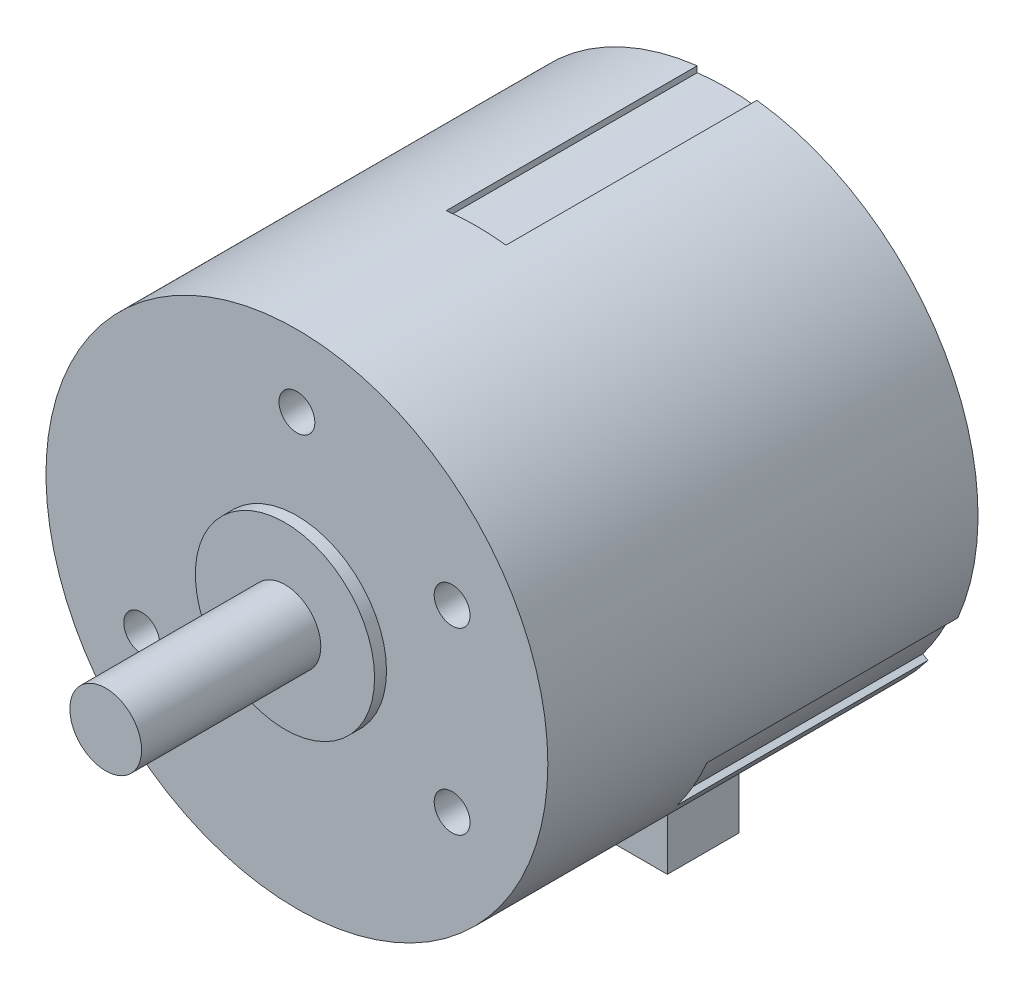
from build123d import *
from build123d.topology import SkipClean

# Parameters (mm, degrees)
SKETCH_1_R          = 21
EXTRUDE_1_DEPTH     = 15
EXTRUDE_START       = 6
EXTRUDE_2_DEPTH     = 6
EXTRUDE_3_DEPTH     = 6
EXTRUDE_START_2     = 9
EXTRUDE_4_DEPTH     = 9
SKETCH_6_R          = 7.5
EXTRUDE_5_DEPTH     = 1
SKETCH_7_R          = 3
EXTRUDE_6_DEPTH     = 15
SKETCH_8_R          = 1.5
CUT_EXTRUDE_1_DEPTH = 3


with BuildPart() as part:
    # 草图1 → 凸台-拉伸1 (new body)
    with BuildSketch(Plane.XY):
        Circle(SKETCH_1_R)
    extrude(amount=EXTRUDE_1_DEPTH)

    # 草图2 → 凸台-拉伸2 (add)
    with SkipClean():  # the faces are left unmerged after this step: merging them gives an invalid solid
        with BuildSketch(Plane(origin=(0, 0, 0), x_dir=(-1, 0, 0), z_dir=(0, 0, -1)).offset(EXTRUDE_START)):
            with BuildLine():
                Line((2.5, 20.850659462), (2.5, 20.346989949))
                ThreePointArc((2.5, 20.346989949), (0, 20.5), (-2.5, 20.346989949))
                Line((-2.5, 20.346989949), (-2.5, 20.850659462))
                ThreePointArc((-2.5, 20.850659462), (-18.186533479, 10.5), (-19.30720078, -8.260266222))
                Line((-19.30720078, -8.260266222), (-18.871010187, -8.008431465))
                ThreePointArc((-18.871010187, -8.008431465), (-17.753520778, -10.25), (-16.371010187, -12.338558484))
                Line((-16.371010187, -12.338558484), (-16.80720078, -12.59039324))
                ThreePointArc((-16.80720078, -12.59039324), (-15.938440593, -13.673555187), (-15, -14.696938457))
                Line((-15, -14.696938457), (-15, -13.973188612))
                ThreePointArc((-15, -13.973188612), (0, -20.5), (15, -13.973188612))
                Line((15, -13.973188612), (15, -14.696938457))
                ThreePointArc((15, -14.696938457), (15.938440593, -13.673555187), (16.80720078, -12.59039324))
                Line((16.80720078, -12.59039324), (16.371010187, -12.338558484))
                ThreePointArc((16.371010187, -12.338558484), (17.753520778, -10.25), (18.871010187, -8.008431465))
                Line((18.871010187, -8.008431465), (19.30720078, -8.260266222))
                ThreePointArc((19.30720078, -8.260266222), (18.186533479, 10.5), (2.5, 20.850659462))
            make_face()
        extrude(amount=-EXTRUDE_2_DEPTH)

    # 草图4 → 凸台-拉伸3 (add)
    with SkipClean():  # the faces are left unmerged after this step: merging them gives an invalid solid
        with BuildSketch(Plane(origin=(0, 0, -6), x_dir=(-1, 0, 0), z_dir=(0, 0, -1)).offset(EXTRUDE_START)):
            with BuildLine():
                Line((10, -17.895530168), (10, -24))
                Line((10, -24), (-10, -24))
                Line((-10, -24), (-10, -17.895530168))
                ThreePointArc((-10, -17.895530168), (-12.652912345, -16.129284212), (-15, -13.973188612))
                Line((-15, -13.973188612), (-15, -14.696938457))
                ThreePointArc((-15, -14.696938457), (-15.938440593, -13.673555187), (-16.80720078, -12.59039324))
                Line((-16.80720078, -12.59039324), (-16.371010187, -12.338558484))
                ThreePointArc((-16.371010187, -12.338558484), (-17.753520778, -10.25), (-18.871010187, -8.008431465))
                Line((-18.871010187, -8.008431465), (-19.30720078, -8.260266222))
                ThreePointArc((-19.30720078, -8.260266222), (-18.186533479, 10.5), (-2.5, 20.850659462))
                Line((-2.5, 20.850659462), (-2.5, 20.346989949))
                ThreePointArc((-2.5, 20.346989949), (0, 20.5), (2.5, 20.346989949))
                Line((2.5, 20.346989949), (2.5, 20.850659462))
                ThreePointArc((2.5, 20.850659462), (18.186533479, 10.5), (19.30720078, -8.260266222))
                Line((19.30720078, -8.260266222), (18.871010187, -8.008431465))
                ThreePointArc((18.871010187, -8.008431465), (17.753520778, -10.25), (16.371010187, -12.338558484))
                Line((16.371010187, -12.338558484), (16.80720078, -12.59039324))
                ThreePointArc((16.80720078, -12.59039324), (15.938440593, -13.673555187), (15, -14.696938457))
                Line((15, -14.696938457), (15, -13.973188612))
                ThreePointArc((15, -13.973188612), (12.652912345, -16.129284212), (10, -17.895530168))
            make_face()
        extrude(amount=-EXTRUDE_3_DEPTH)

    # 草图5 → 凸台-拉伸4 (add)
    with SkipClean():  # the faces are left unmerged after this step: merging them gives an invalid solid
        with BuildSketch(Plane(origin=(0, 0, -12), x_dir=(-1, 0, 0), z_dir=(0, 0, -1)).offset(EXTRUDE_START_2)):
            with BuildLine():
                Line((18.871010187, -8.008431465), (19.30720078, -8.260266222))
                ThreePointArc((19.30720078, -8.260266222), (18.186533479, 10.5), (2.5, 20.850659462))
                Line((2.5, 20.850659462), (2.5, 20.346989949))
                ThreePointArc((2.5, 20.346989949), (0, 20.5), (-2.5, 20.346989949))
                Line((-2.5, 20.346989949), (-2.5, 20.850659462))
                ThreePointArc((-2.5, 20.850659462), (-18.186533479, 10.5), (-19.30720078, -8.260266222))
                Line((-19.30720078, -8.260266222), (-18.871010187, -8.008431465))
                ThreePointArc((-18.871010187, -8.008431465), (-17.753520778, -10.25), (-16.371010187, -12.338558484))
                Line((-16.371010187, -12.338558484), (-16.80720078, -12.59039324))
                ThreePointArc((-16.80720078, -12.59039324), (-15.938440593, -13.673555187), (-15, -14.696938457))
                ThreePointArc((-15, -14.696938457), (0, -21), (15, -14.696938457))
                ThreePointArc((15, -14.696938457), (15.938440593, -13.673555187), (16.80720078, -12.59039324))
                Line((16.80720078, -12.59039324), (16.371010187, -12.338558484))
                ThreePointArc((16.371010187, -12.338558484), (17.753520778, -10.25), (18.871010187, -8.008431465))
            make_face()
        extrude(amount=-EXTRUDE_4_DEPTH)

    # 草图6 → 凸台-拉伸5 (add)
    with SkipClean():  # the faces are left unmerged after this step: merging them gives an invalid solid
        with BuildSketch(Plane.XY.offset(15)):
            Circle(SKETCH_6_R)
        extrude(amount=EXTRUDE_5_DEPTH)

    # 草图7 → 凸台-拉伸6 (add)
    with SkipClean():  # the faces are left unmerged after this step: merging them gives an invalid solid
        with BuildSketch(Plane.XY.offset(16)):
            Circle(SKETCH_7_R)
        extrude(amount=EXTRUDE_6_DEPTH)

    # 草图8 → 切除-拉伸1 (cut)
    with SkipClean():  # the faces are left unmerged after this step: merging them gives an invalid solid
        with BuildSketch(Plane.XY.offset(15)):
            with Locations((0, 15)):
                Circle(SKETCH_8_R)
            with Locations((12.990381057, 7.5)):
                Circle(SKETCH_8_R)
            with Locations((12.990381057, -7.5)):
                Circle(SKETCH_8_R)
            with Locations((-12.990381057, -7.5)):
                Circle(SKETCH_8_R)
        extrude(amount=-CUT_EXTRUDE_1_DEPTH, mode=Mode.SUBTRACT)


solid = part.part
